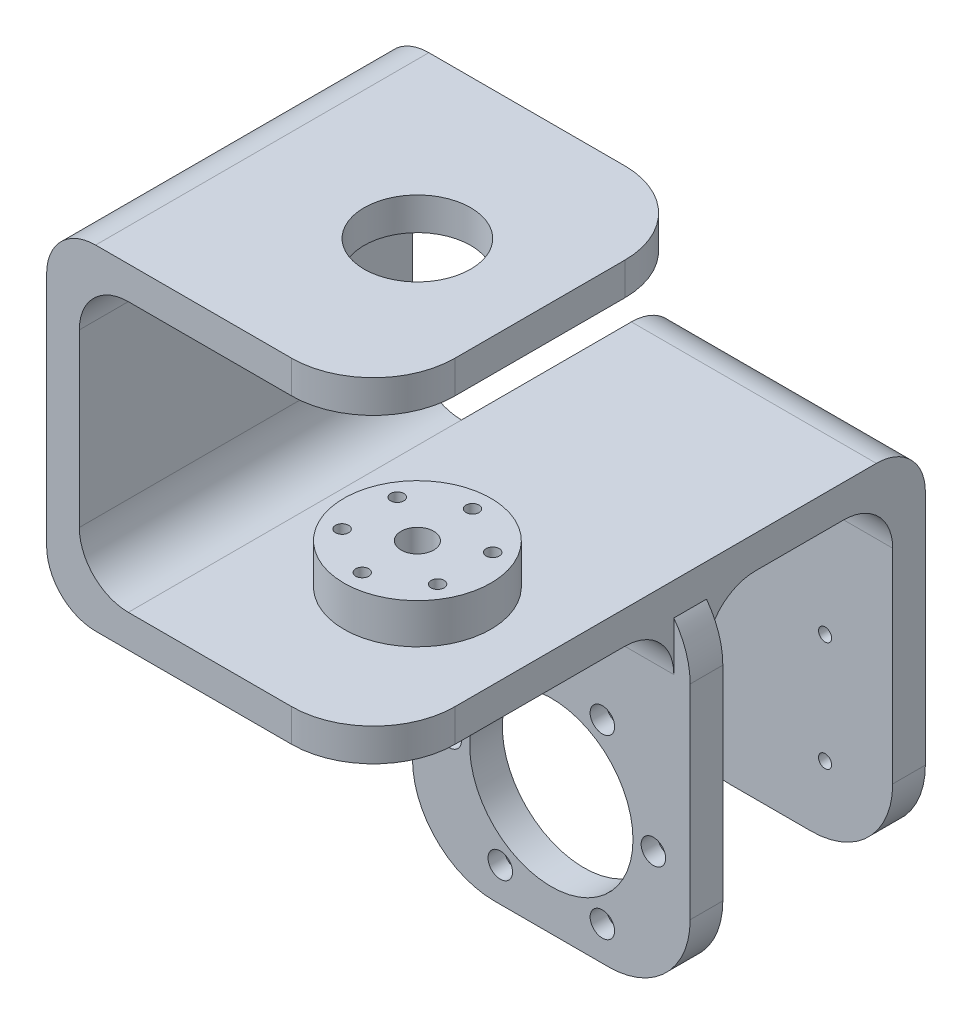
from build123d import *

# Parameters (mm, degrees)
SKETCH_1_W                      = 80
SKETCH_1_H                      = 81.6
EXTRUDE_1_DEPTH                 = 8
SKETCH_2_W                      = 8
SKETCH_2_H                      = 81.6
EXTRUDE_2_DEPTH                 = 52.9
SKETCH_10_W                     = 8
SKETCH_10_H                     = 81.6
EXTRUDE_7_DEPTH                 = 13
SKETCH_11_W                     = 80
SKETCH_11_H                     = 81.6
EXTRUDE_8_DEPTH                 = 8
SKETCH_6_R                      = 18
EXTRUDE_4_DEPTH                 = 9.8
SKETCH_4_R                      = 1.6
SKETCH_4_R_2                    = 4
CUT_EXTRUDE_1_DEPTH             = 94.412258296
CUT_EXTRUDE_1_DIRECTION_2_REACH = 95.412
CUT_EXTRUDE_3_REACH             = 95.412
SKETCH_12_R                     = 13.05
SKETCH_21_R                     = 3
CUT_EXTRUDE_10_DEPTH            = 4
SKETCH1_W                       = 68
SKETCH1_H                       = 8
BOSS_EXTRUDE1_DEPTH             = 82
SKETCH2_W                       = 60
SKETCH2_H                       = 8
BOSS_EXTRUDE2_DEPTH             = 53.6
SKETCH3_W                       = 60
SKETCH3_H                       = 90
BOSS_EXTRUDE3_DEPTH             = 8
CUT_EXTRUDE1_REACH              = 121.87
SKETCH4_R                       = 20
SKETCH4_R_2                     = 1.6
CUT_EXTRUDE2_REACH              = 176.266
SKETCH5_R                       = 1.6
SKETCH6_R                       = 3
CUT_EXTRUDE3_DEPTH              = 4
SKETCH7_R                       = 3
CUT_EXTRUDE4_DEPTH              = 4
FILLET1_R                       = 12
FILLET2_R                       = 20


with BuildPart() as part:
    # 草图1 → 凸台-拉伸1 (new body)
    with BuildSketch(Plane(origin=(0, 0, 0), x_dir=(1, 0, 0), z_dir=(0, 1, 0))):
        Rectangle(SKETCH_1_W, SKETCH_1_H)
    extrude(amount=EXTRUDE_1_DEPTH)

    # 草图2 → 凸台-拉伸2 (add)
    with BuildSketch(Plane(origin=(0, 8, 0), x_dir=(1, 0, 0), z_dir=(0, 1, 0))):
        with Locations((-36, 0)):
            Rectangle(SKETCH_2_W, SKETCH_2_H)
    extrude(amount=EXTRUDE_2_DEPTH)

    # 草图10 → 凸台-拉伸7 (add)
    with BuildSketch(Plane(origin=(0, 60.9, 0), x_dir=(1, 0, 0), z_dir=(0, 1, 0))):
        with Locations((-36, 0)):
            Rectangle(SKETCH_10_W, SKETCH_10_H)
    extrude(amount=EXTRUDE_7_DEPTH)

    # 草图11 → 凸台-拉伸8 (add)
    with BuildSketch(Plane(origin=(0, 73.9, 0), x_dir=(1, 0, 0), z_dir=(0, 1, 0))):
        Rectangle(SKETCH_11_W, SKETCH_11_H)
    extrude(amount=EXTRUDE_8_DEPTH)

    # 草图6 → 凸台-拉伸4 (add)
    with BuildSketch(Plane(origin=(0, 8, 0), x_dir=(1, 0, 0), z_dir=(0, 1, 0))):
        with Locations(Location((10, 0, 0), (0, 0, 270))):
            Circle(SKETCH_6_R)
    extrude(amount=EXTRUDE_4_DEPTH)

    # 草图4 → 切除-拉伸1 (cut)
    with BuildSketch(Plane(origin=(0, 8, 0), x_dir=(1, 0, 0), z_dir=(0, 1, 0))):
        with Locations(Location((10, 13.5, 0), (0, 0, 270))):
            Circle(SKETCH_4_R)
        with Locations(Location((21.691342951, 6.75, 0), (0, 0, 270))):
            Circle(SKETCH_4_R)
        with Locations(Location((21.691342951, -6.75, 0), (0, 0, 270))):
            Circle(SKETCH_4_R)
        with Locations(Location((10, -13.5, 0), (0, 0, 270))):
            Circle(SKETCH_4_R)
        with Locations(Location((-1.691342951, -6.75, 0), (0, 0, 270))):
            Circle(SKETCH_4_R)
        with Locations(Location((-1.691342951, 6.75, 0), (0, 0, 270))):
            Circle(SKETCH_4_R)
        with Locations(Location((10, 0, 0), (0, 0, 270))):
            Circle(SKETCH_4_R_2)
    extrude(amount=-CUT_EXTRUDE_1_DEPTH, mode=Mode.SUBTRACT)

    # 草图4 → 切除-拉伸1 direction 2 (cut, up to next)
    with BuildSketch(Plane(origin=(0, 8, 0), x_dir=(1, 0, 0), z_dir=(0, 1, 0)), mode=Mode.PRIVATE) as cut_extrude_1_direction_2_sk1:
        with Locations(Location((10, 13.5, 0), (0, 0, 270))):
            Circle(SKETCH_4_R)
    cut_extrude_1_direction_2_tool1 = extrude(cut_extrude_1_direction_2_sk1.sketch, amount=CUT_EXTRUDE_1_DIRECTION_2_REACH, mode=Mode.PRIVATE) & part.part
    # 草图4 → 切除-拉伸1 direction 2 (cut, up to next)
    with BuildSketch(Plane(origin=(0, 8, 0), x_dir=(1, 0, 0), z_dir=(0, 1, 0)), mode=Mode.PRIVATE) as cut_extrude_1_direction_2_sk2:
        with Locations(Location((21.691342951, 6.75, 0), (0, 0, 270))):
            Circle(SKETCH_4_R)
    cut_extrude_1_direction_2_tool2 = extrude(cut_extrude_1_direction_2_sk2.sketch, amount=CUT_EXTRUDE_1_DIRECTION_2_REACH, mode=Mode.PRIVATE) & part.part
    # 草图4 → 切除-拉伸1 direction 2 (cut, up to next)
    with BuildSketch(Plane(origin=(0, 8, 0), x_dir=(1, 0, 0), z_dir=(0, 1, 0)), mode=Mode.PRIVATE) as cut_extrude_1_direction_2_sk3:
        with Locations(Location((21.691342951, -6.75, 0), (0, 0, 270))):
            Circle(SKETCH_4_R)
    cut_extrude_1_direction_2_tool3 = extrude(cut_extrude_1_direction_2_sk3.sketch, amount=CUT_EXTRUDE_1_DIRECTION_2_REACH, mode=Mode.PRIVATE) & part.part
    # 草图4 → 切除-拉伸1 direction 2 (cut, up to next)
    with BuildSketch(Plane(origin=(0, 8, 0), x_dir=(1, 0, 0), z_dir=(0, 1, 0)), mode=Mode.PRIVATE) as cut_extrude_1_direction_2_sk4:
        with Locations(Location((10, -13.5, 0), (0, 0, 270))):
            Circle(SKETCH_4_R)
    cut_extrude_1_direction_2_tool4 = extrude(cut_extrude_1_direction_2_sk4.sketch, amount=CUT_EXTRUDE_1_DIRECTION_2_REACH, mode=Mode.PRIVATE) & part.part
    # 草图4 → 切除-拉伸1 direction 2 (cut, up to next)
    with BuildSketch(Plane(origin=(0, 8, 0), x_dir=(1, 0, 0), z_dir=(0, 1, 0)), mode=Mode.PRIVATE) as cut_extrude_1_direction_2_sk5:
        with Locations(Location((-1.691342951, -6.75, 0), (0, 0, 270))):
            Circle(SKETCH_4_R)
    cut_extrude_1_direction_2_tool5 = extrude(cut_extrude_1_direction_2_sk5.sketch, amount=CUT_EXTRUDE_1_DIRECTION_2_REACH, mode=Mode.PRIVATE) & part.part
    # 草图4 → 切除-拉伸1 direction 2 (cut, up to next)
    with BuildSketch(Plane(origin=(0, 8, 0), x_dir=(1, 0, 0), z_dir=(0, 1, 0)), mode=Mode.PRIVATE) as cut_extrude_1_direction_2_sk6:
        with Locations(Location((-1.691342951, 6.75, 0), (0, 0, 270))):
            Circle(SKETCH_4_R)
    cut_extrude_1_direction_2_tool6 = extrude(cut_extrude_1_direction_2_sk6.sketch, amount=CUT_EXTRUDE_1_DIRECTION_2_REACH, mode=Mode.PRIVATE) & part.part
    # 草图4 → 切除-拉伸1 direction 2 (cut, up to next)
    with BuildSketch(Plane(origin=(0, 8, 0), x_dir=(1, 0, 0), z_dir=(0, 1, 0)), mode=Mode.PRIVATE) as cut_extrude_1_direction_2_sk7:
        with Locations(Location((10, 0, 0), (0, 0, 270))):
            Circle(SKETCH_4_R_2)
    cut_extrude_1_direction_2_tool7 = extrude(cut_extrude_1_direction_2_sk7.sketch, amount=CUT_EXTRUDE_1_DIRECTION_2_REACH, mode=Mode.PRIVATE) & part.part
    add(cut_extrude_1_direction_2_tool1.solids().sort_by_distance((10, 8, -13.5))[0], mode=Mode.SUBTRACT)
    add(cut_extrude_1_direction_2_tool2.solids().sort_by_distance((21.691343, 8, -6.75))[0], mode=Mode.SUBTRACT)
    add(cut_extrude_1_direction_2_tool3.solids().sort_by_distance((21.691343, 8, 6.75))[0], mode=Mode.SUBTRACT)
    add(cut_extrude_1_direction_2_tool4.solids().sort_by_distance((10, 8, 13.5))[0], mode=Mode.SUBTRACT)
    add(cut_extrude_1_direction_2_tool5.solids().sort_by_distance((-1.691343, 8, 6.75))[0], mode=Mode.SUBTRACT)
    add(cut_extrude_1_direction_2_tool6.solids().sort_by_distance((-1.691343, 8, -6.75))[0], mode=Mode.SUBTRACT)
    add(cut_extrude_1_direction_2_tool7.solids().sort_by_distance((10, 8, 0))[0], mode=Mode.SUBTRACT)

    # 草图12 → 切除-拉伸3 (cut, up to next)
    with BuildSketch(Plane(origin=(0, 73.9, 0), x_dir=(-1, 0, 0), z_dir=(0, -1, 0)), mode=Mode.PRIVATE) as cut_extrude_3_sk1:
        with Locations(Location((-10, 0, 0), (0, 0, 90))):
            Circle(SKETCH_12_R)
    cut_extrude_3_tool1 = extrude(cut_extrude_3_sk1.sketch, amount=-CUT_EXTRUDE_3_REACH, mode=Mode.PRIVATE) & part.part
    add(cut_extrude_3_tool1.solids().sort_by_distance((10, 73.9, 0))[0], mode=Mode.SUBTRACT)

    # 草图21 → 切除-拉伸10 (cut)
    with BuildSketch(Plane(origin=(0, 0, 0), x_dir=(-1, 0, 0), z_dir=(0, -1, 0))):
        with Locations(Location((-10, -13.5, 0), (0, 0, 90))):
            Circle(SKETCH_21_R)
        with Locations(Location((-21.691342951, -6.75, 0), (0, 0, 90))):
            Circle(SKETCH_21_R)
        with Locations(Location((-21.691342951, 6.75, 0), (0, 0, 90))):
            Circle(SKETCH_21_R)
        with Locations(Location((-10, 13.5, 0), (0, 0, 90))):
            Circle(SKETCH_21_R)
        with Locations(Location((1.691342951, 6.75, 0), (0, 0, 90))):
            Circle(SKETCH_21_R)
        with Locations(Location((1.691342951, -6.75, 0), (0, 0, 90))):
            Circle(SKETCH_21_R)
    extrude(amount=-CUT_EXTRUDE_10_DEPTH, mode=Mode.SUBTRACT)

    # Sketch1 → Boss-Extrude1 (add)
    with BuildSketch(Plane(origin=(0, 0, 0), x_dir=(-1, 0, 0), z_dir=(0, -1, 0))):
        with Locations((-10, 36.8)):
            Rectangle(SKETCH1_W, SKETCH1_H)
    extrude(amount=BOSS_EXTRUDE1_DEPTH)

    # Sketch2 → Boss-Extrude2 (add)
    with BuildSketch(Plane(origin=(0.8, 0, -40.8), x_dir=(1, 0, 0), z_dir=(0, 0, 1))):
        with Locations((9.2, 4)):
            Rectangle(SKETCH2_W, SKETCH2_H)
    extrude(amount=-BOSS_EXTRUDE2_DEPTH)

    # Sketch3 → Boss-Extrude3 (add)
    with BuildSketch(Plane(origin=(0, 94.4, -94.4), x_dir=(-1, 0, 0), z_dir=(0, 0, 1))):
        with Locations((-10, 131.4)):
            Rectangle(SKETCH3_W, SKETCH3_H)
    extrude(amount=BOSS_EXTRUDE3_DEPTH)

    # Sketch4 → Cut-Extrude1 (cut, up to next)
    with BuildSketch(Plane(origin=(7.2, 0, -32.8), x_dir=(1, 0, 0), z_dir=(0, 0, 1)), mode=Mode.PRIVATE) as cut_extrude1_sk1:
        with Locations((2.8, -52)):
            Circle(SKETCH4_R)
    cut_extrude1_tool1 = extrude(cut_extrude1_sk1.sketch, amount=-CUT_EXTRUDE1_REACH, mode=Mode.PRIVATE) & part.part
    # Sketch4 → Cut-Extrude1 (cut, up to next)
    with BuildSketch(Plane(origin=(7.2, 0, -32.8), x_dir=(1, 0, 0), z_dir=(0, 0, 1)), mode=Mode.PRIVATE) as cut_extrude1_sk2:
        with Locations((27.8, -52)):
            Circle(SKETCH4_R_2)
    cut_extrude1_tool2 = extrude(cut_extrude1_sk2.sketch, amount=-CUT_EXTRUDE1_REACH, mode=Mode.PRIVATE) & part.part
    # Sketch4 → Cut-Extrude1 (cut, up to next)
    with BuildSketch(Plane(origin=(7.2, 0, -32.8), x_dir=(1, 0, 0), z_dir=(0, 0, 1)), mode=Mode.PRIVATE) as cut_extrude1_sk3:
        with Locations((15.3, -73.650635095)):
            Circle(SKETCH4_R_2)
    cut_extrude1_tool3 = extrude(cut_extrude1_sk3.sketch, amount=-CUT_EXTRUDE1_REACH, mode=Mode.PRIVATE) & part.part
    # Sketch4 → Cut-Extrude1 (cut, up to next)
    with BuildSketch(Plane(origin=(7.2, 0, -32.8), x_dir=(1, 0, 0), z_dir=(0, 0, 1)), mode=Mode.PRIVATE) as cut_extrude1_sk4:
        with Locations((-9.7, -73.650635095)):
            Circle(SKETCH4_R_2)
    cut_extrude1_tool4 = extrude(cut_extrude1_sk4.sketch, amount=-CUT_EXTRUDE1_REACH, mode=Mode.PRIVATE) & part.part
    # Sketch4 → Cut-Extrude1 (cut, up to next)
    with BuildSketch(Plane(origin=(7.2, 0, -32.8), x_dir=(1, 0, 0), z_dir=(0, 0, 1)), mode=Mode.PRIVATE) as cut_extrude1_sk5:
        with Locations((-22.2, -52)):
            Circle(SKETCH4_R_2)
    cut_extrude1_tool5 = extrude(cut_extrude1_sk5.sketch, amount=-CUT_EXTRUDE1_REACH, mode=Mode.PRIVATE) & part.part
    # Sketch4 → Cut-Extrude1 (cut, up to next)
    with BuildSketch(Plane(origin=(7.2, 0, -32.8), x_dir=(1, 0, 0), z_dir=(0, 0, 1)), mode=Mode.PRIVATE) as cut_extrude1_sk6:
        with Locations((-9.7, -30.349364905)):
            Circle(SKETCH4_R_2)
    cut_extrude1_tool6 = extrude(cut_extrude1_sk6.sketch, amount=-CUT_EXTRUDE1_REACH, mode=Mode.PRIVATE) & part.part
    # Sketch4 → Cut-Extrude1 (cut, up to next)
    with BuildSketch(Plane(origin=(7.2, 0, -32.8), x_dir=(1, 0, 0), z_dir=(0, 0, 1)), mode=Mode.PRIVATE) as cut_extrude1_sk7:
        with Locations((15.3, -30.349364905)):
            Circle(SKETCH4_R_2)
    cut_extrude1_tool7 = extrude(cut_extrude1_sk7.sketch, amount=-CUT_EXTRUDE1_REACH, mode=Mode.PRIVATE) & part.part
    add(cut_extrude1_tool1.solids().sort_by_distance((10, -52, -32.8))[0], mode=Mode.SUBTRACT)
    add(cut_extrude1_tool2.solids().sort_by_distance((35, -52, -32.8))[0], mode=Mode.SUBTRACT)
    add(cut_extrude1_tool3.solids().sort_by_distance((22.5, -73.650635, -32.8))[0], mode=Mode.SUBTRACT)
    add(cut_extrude1_tool4.solids().sort_by_distance((-2.5, -73.650635, -32.8))[0], mode=Mode.SUBTRACT)
    add(cut_extrude1_tool5.solids().sort_by_distance((-15, -52, -32.8))[0], mode=Mode.SUBTRACT)
    add(cut_extrude1_tool6.solids().sort_by_distance((-2.5, -30.349365, -32.8))[0], mode=Mode.SUBTRACT)
    add(cut_extrude1_tool7.solids().sort_by_distance((22.5, -30.349365, -32.8))[0], mode=Mode.SUBTRACT)

    # Sketch5 → Cut-Extrude2 (cut, up to next)
    with BuildSketch(Plane(origin=(46.4, 0, -86.4), x_dir=(1, 0, 0), z_dir=(0, 0, 1)), mode=Mode.PRIVATE) as cut_extrude2_sk1:
        with Locations((-49.835028843, -38.564971157)):
            Circle(SKETCH5_R)
    cut_extrude2_tool1 = extrude(cut_extrude2_sk1.sketch, amount=-CUT_EXTRUDE2_REACH, mode=Mode.PRIVATE) & part.part
    # Sketch5 → Cut-Extrude2 (cut, up to next)
    with BuildSketch(Plane(origin=(46.4, 0, -86.4), x_dir=(1, 0, 0), z_dir=(0, 0, 1)), mode=Mode.PRIVATE) as cut_extrude2_sk2:
        with Locations((-22.964971157, -38.564971157)):
            Circle(SKETCH5_R)
    cut_extrude2_tool2 = extrude(cut_extrude2_sk2.sketch, amount=-CUT_EXTRUDE2_REACH, mode=Mode.PRIVATE) & part.part
    # Sketch5 → Cut-Extrude2 (cut, up to next)
    with BuildSketch(Plane(origin=(46.4, 0, -86.4), x_dir=(1, 0, 0), z_dir=(0, 0, 1)), mode=Mode.PRIVATE) as cut_extrude2_sk3:
        with Locations((-22.964971157, -65.435028843)):
            Circle(SKETCH5_R)
    cut_extrude2_tool3 = extrude(cut_extrude2_sk3.sketch, amount=-CUT_EXTRUDE2_REACH, mode=Mode.PRIVATE) & part.part
    # Sketch5 → Cut-Extrude2 (cut, up to next)
    with BuildSketch(Plane(origin=(46.4, 0, -86.4), x_dir=(1, 0, 0), z_dir=(0, 0, 1)), mode=Mode.PRIVATE) as cut_extrude2_sk4:
        with Locations((-49.835028843, -65.435028843)):
            Circle(SKETCH5_R)
    cut_extrude2_tool4 = extrude(cut_extrude2_sk4.sketch, amount=-CUT_EXTRUDE2_REACH, mode=Mode.PRIVATE) & part.part
    add(cut_extrude2_tool1.solids().sort_by_distance((-3.435029, -38.564971, -86.4))[0], mode=Mode.SUBTRACT)
    add(cut_extrude2_tool2.solids().sort_by_distance((23.435029, -38.564971, -86.4))[0], mode=Mode.SUBTRACT)
    add(cut_extrude2_tool3.solids().sort_by_distance((23.435029, -65.435029, -86.4))[0], mode=Mode.SUBTRACT)
    add(cut_extrude2_tool4.solids().sort_by_distance((-3.435029, -65.435029, -86.4))[0], mode=Mode.SUBTRACT)

    # Sketch6 → Cut-Extrude3 (cut)
    with BuildSketch(Plane(origin=(0, 0, -94.4), x_dir=(-1, 0, 0), z_dir=(0, 0, -1))):
        with Locations((-23.435028843, -38.564971157)):
            Circle(SKETCH6_R)
        with Locations((3.435028843, -38.564971157)):
            Circle(SKETCH6_R)
        with Locations((3.435028843, -65.435028843)):
            Circle(SKETCH6_R)
        with Locations((-23.435028843, -65.435028843)):
            Circle(SKETCH6_R)
    extrude(amount=-CUT_EXTRUDE3_DEPTH, mode=Mode.SUBTRACT)

    # Sketch7 → Cut-Extrude4 (cut)
    with BuildSketch(Plane(origin=(72.8, 0, -32.8), x_dir=(-1, 0, 0), z_dir=(0, 0, -1))):
        with Locations((75.3, -30.349364905)):
            Circle(SKETCH7_R)
        with Locations((87.8, -52)):
            Circle(SKETCH7_R)
        with Locations((75.3, -73.650635095)):
            Circle(SKETCH7_R)
        with Locations((50.3, -73.650635095)):
            Circle(SKETCH7_R)
        with Locations((37.8, -52)):
            Circle(SKETCH7_R)
        with Locations((50.3, -30.349364905)):
            Circle(SKETCH7_R)
    extrude(amount=CUT_EXTRUDE4_DEPTH, mode=Mode.SUBTRACT)

    # Fillet1
    fillet1_edges = [part.edges().sort_by_distance(p)[0] for p in [
        (-32, 8, 0),
        (10, 8, -94.4),
        (-32, 73.9, 0),
        (-40, 81.9, 0),
        (-40, 0, 0),
        (8, 0, -32.8),
        (10, 0, -40.8),
        (10, 0, -86.4),
    ]]
    fillet(fillet1_edges, radius=FILLET1_R)

    # Fillet2
    # the kernel refuses this fillet: 20 mm, written as the material it takes off along each edge
    with BuildSketch(Plane(origin=(40, -50, 40.8), x_dir=(-1, 0, 0), z_dir=(0, 1, 0)), Plane(origin=(40, 23.9, 40.8), x_dir=(-1, 0, 0), z_dir=(0, 1, 0)), Plane(origin=(-24, -82, -90.8), x_dir=(0, 1, 0), z_dir=(0, 0, 1))) as fillet2_piece_1:
        with BuildLine():
            CenterArc((FILLET2_R, -FILLET2_R), FILLET2_R, 90, 90)
            Line((0, -FILLET2_R), (0, 0))
            Line((0, 0), (FILLET2_R, 0))
        make_face()
    extrude(amount=108, mode=Mode.SUBTRACT)
    with BuildSketch(Plane(origin=(40, 23.9, -40.8), x_dir=(-1, 0, 0), z_dir=(0, 1, 0)), Plane(origin=(44, -82, 17.2), x_dir=(-1, 0, 0), z_dir=(0, 0, -1))) as fillet2_piece_2:
        with BuildLine():
            CenterArc((FILLET2_R, FILLET2_R), FILLET2_R, 180, 90)
            Line((0, FILLET2_R), (0, 0))
            Line((0, 0), (FILLET2_R, 0))
        make_face()
    extrude(amount=108, mode=Mode.SUBTRACT)
    with BuildSketch(Plane(origin=(-20, -82, -144.4), x_dir=(1, 0, 0), z_dir=(0, 0, 1))) as fillet2_piece_3:
        with BuildLine():
            CenterArc((FILLET2_R, FILLET2_R), FILLET2_R, 180, 90)
            Line((0, FILLET2_R), (0, 0))
            Line((0, 0), (FILLET2_R, 0))
        make_face()
    extrude(amount=58, mode=Mode.SUBTRACT)
    with BuildSketch(Plane(origin=(40, -82, -144.4), x_dir=(-1, 0, 0), z_dir=(0, 0, 1))) as fillet2_piece_4:
        with BuildLine():
            CenterArc((FILLET2_R, -FILLET2_R), FILLET2_R, 90, 90)
            Line((0, -FILLET2_R), (0, 0))
            Line((0, 0), (FILLET2_R, 0))
        make_face()
    extrude(amount=58, mode=Mode.SUBTRACT)
    with BuildSketch(Plane(origin=(44, 0, -2.8), x_dir=(0, -1, 0), z_dir=(0, 0, -1))) as fillet2_piece_5:
        with BuildLine():
            CenterArc((12, 20), FILLET2_R, 233.130102354, 36.869897646)
            Line((0, 4), (0, 0))
            Line((0, 0), (12, 0))
        make_face()
    extrude(amount=68, mode=Mode.SUBTRACT)


solid = part.part
